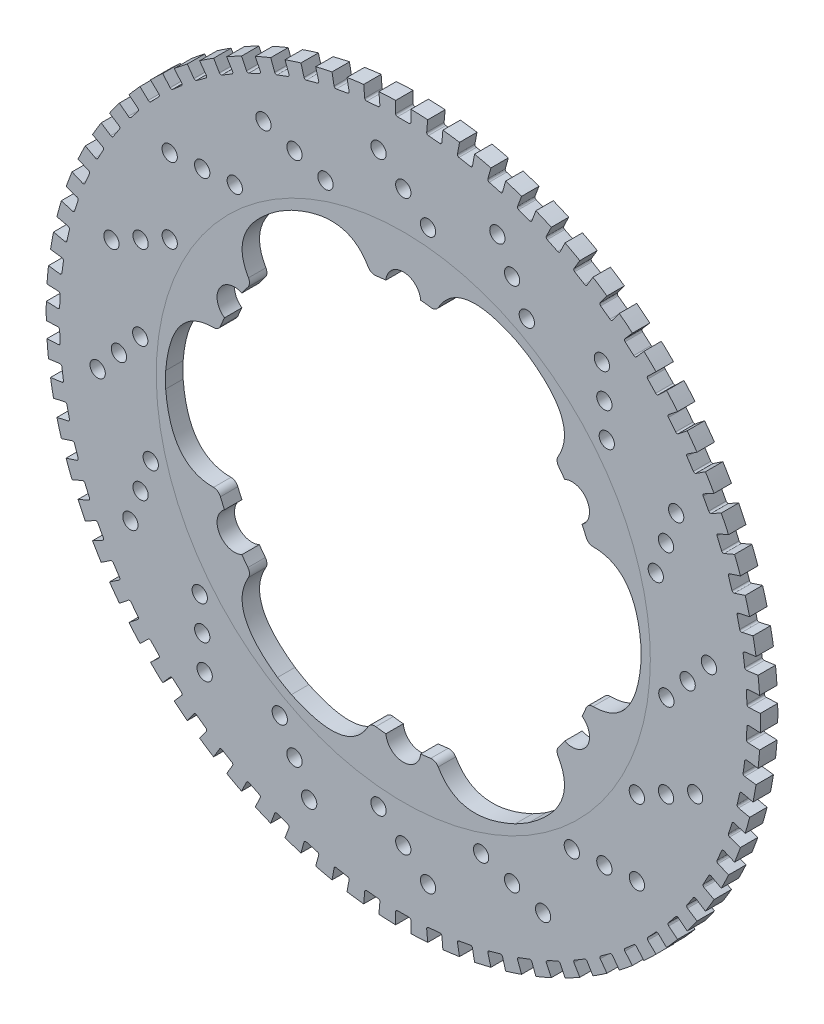
from build123d import *

# Parameters (mm, degrees)
SKETCH2_R                = 95.25
SKETCH2_R_2              = 64.77
ROTORSWEPT_DEPTH         = 4.7498
FLOATPINIF_DEPTH         = 4.7498
FLOATPINPATTERN_COUNT    = 6
SKETCH4_R                = 2.0828
HOLES_DEPTH              = 135.787557434
HOLESPATTERN_COUNT       = 16
FILLET1_R                = 2.032
BOSS_EXTRUDE2_START      = -4.7498
SKETCH8_R                = 97.282
SKETCH8_R_2              = 95.25
BOSS_EXTRUDE2_DEPTH      = 4.7498
SKETCH12_W               = 2.07772
SKETCH12_H               = 4.412748634
CUT_EXTRUDE8_DEPTH       = 4.826
FILLET3_R                = 0.508
CIRPATTERN2_COUNT        = 70
FILLET3_OF_CIRPATTERN2_R = 0.508


with BuildPart() as part:
    # Sketch2 → RotorSwept (new body)
    with BuildSketch(Plane.XY):
        Circle(SKETCH2_R)
        Circle(SKETCH2_R_2, mode=Mode.SUBTRACT)
    extrude(amount=ROTORSWEPT_DEPTH)

    # Sketch3 → FloatPinIF (add, through all)
    with BuildSketch(Plane.XY.offset(4.7498)):
        with BuildLine():
            ThreePointArc((-4.743483699, 53.511168959), (0, 57.8485), (4.743483699, 53.511168959))
            ThreePointArc((4.743483699, 53.511168959), (6.821907433, 53.286090305), (8.89, 52.980314656))
            add(Edge.make_bspline(
                [(8.89, 52.980314656), (14.425343999, 64.673785156), (30.48, 57.15)],
                knots=[0, 0, 0, 1, 1, 1], degree=2))
            ThreePointArc((30.48, 57.15), (0, 64.77), (-30.48, 57.15))
            add(Edge.make_bspline(
                [(-8.89, 52.980314656), (-14.425343999, 64.673785156), (-30.48, 57.15)],
                knots=[0, 0, 0, 1, 1, 1], degree=2))
            ThreePointArc((-8.89, 52.980314656), (-6.821907433, 53.286090305), (-4.743483699, 53.511168959))
        make_face()
    floatpinif = extrude(amount=-FLOATPINIF_DEPTH)

    # FloatPinPattern: FloatPinIF ×6 about axis
    floatpinpattern_axis = Axis((0, 0, 4.7498), (0, 0, -1))
    for i in range(1, FLOATPINPATTERN_COUNT):
        add(floatpinif.rotate(floatpinpattern_axis, i * 360 / FLOATPINPATTERN_COUNT))

    # Sketch4 → Holes (cut, through all)
    with BuildSketch(Plane.XY.offset(4.7498)):
        with Locations((0, 77.47)):
            Circle(SKETCH4_R)
        with Locations((-6.740084385, 83.266840733)):
            Circle(SKETCH4_R)
        with Locations((6.740084385, 71.673159267)):
            Circle(SKETCH4_R)
    holes = extrude(amount=-HOLES_DEPTH, mode=Mode.SUBTRACT)

    # HolesPattern: Holes ×16 about axis
    holespattern_axis = Axis((0, 0, 0), (0, 0, 1))
    for i in range(1, HOLESPATTERN_COUNT):
        add(holes.rotate(holespattern_axis, i * 360 / HOLESPATTERN_COUNT), mode=Mode.SUBTRACT)

    # Fillet1
    fillet1_edges = [part.edges().sort_by_distance(p)[0] for p in [
        (-8.89, -52.980314656, 2.3749),
        (8.89, -52.980314656, 2.3749),
        (41.437298392, -34.189123167, 2.3749),
        (50.327298392, -18.791191488, 2.3749),
        (-50.327298392, -18.791191488, 2.3749),
        (-41.437298392, -34.189123167, 2.3749),
        (-41.437298392, 34.189123167, 2.3749),
        (-50.327298392, 18.791191488, 2.3749),
        (50.327298392, 18.791191488, 2.3749),
        (41.437298392, 34.189123167, 2.3749),
        (8.89, 52.980314656, 2.3749),
        (-8.89, 52.980314656, 2.3749),
    ]]
    fillet(fillet1_edges, radius=FILLET1_R)

    # Sketch8 → Boss-Extrude2 (add)
    with BuildSketch(Plane.XY.offset(4.7498).offset(BOSS_EXTRUDE2_START)):
        Circle(SKETCH8_R)
        Circle(SKETCH8_R_2, mode=Mode.SUBTRACT)
    extrude(amount=BOSS_EXTRUDE2_DEPTH)

    # Sketch12 → Cut-Extrude8 (cut)
    with BuildSketch(Plane.XY.offset(4.7498)):
        with Locations((1.03886, 95.856174317)):
            Rectangle(SKETCH12_W, SKETCH12_H)
        with Locations((-1.03886, 95.856174317)):
            Rectangle(SKETCH12_W, SKETCH12_H)
    cut_extrude8 = extrude(amount=-CUT_EXTRUDE8_DEPTH, mode=Mode.SUBTRACT)

    # Fillet3
    fillet3_edges = [part.edges().sort_by_distance(p)[0] for p in [
        (2.07772, 93.6498, 2.3749),
        (-2.07772, 93.6498, 2.3749),
    ]]
    fillet(fillet3_edges, radius=FILLET3_R)

    # CirPattern2: Cut-Extrude8 ×70 about axis
    cirpattern2_axis = Axis((0, 0, 0), (0, 0, 1))
    for i in range(1, CIRPATTERN2_COUNT):
        add(cut_extrude8.rotate(cirpattern2_axis, i * 360 / CIRPATTERN2_COUNT), mode=Mode.SUBTRACT)

    # Fillet3 of CirPattern2
    fillet3_of_cirpattern2_edges = [part.edges().sort_by_distance(p)[0] for p in [
        (-6.325347641, 93.459038823, 2.3749),
        (-10.464059061, 93.086548053, 2.3749),
        (-14.677487302, 92.515800418, 2.3749),
        (-18.766147671, 91.773817955, 2.3749),
        (-22.911452465, 90.827679186, 2.3749),
        (-26.917142295, 89.722179037, 2.3749),
        (-30.960948085, 88.408266888, 2.3749),
        (-34.851415916, 86.948149889, 2.3749),
        (-38.761164355, 85.277043208, 2.3749),
        (-42.505086428, 83.474065363, 2.3749),
        (-46.249298522, 81.459218918, 2.3749),
        (-49.816530977, 79.327896744, 2.3749),
        (-53.365060531, 76.985532894, 2.3749),
        (-56.72688211, 74.543026545, 2.3749),
        (-60.05115845, 71.892004627, 2.3749),
        (-63.180501743, 69.157979727, 2.3749),
        (-66.253759751, 66.21964421, 2.3749),
        (-69.125429126, 63.216113521, 2.3749),
        (-71.922924736, 60.014122154, 2.3749),
        (-74.513799198, 56.765268338, 2.3749),
        (-77.01300862, 53.325401674, 2.3749),
        (-79.302227973, 49.857382593, 2.3749),
        (-81.483029042, 46.207336415, 2.3749),
        (-83.452161837, 42.548074518, 2.3749),
        (-85.296996025, 38.717236853, 2.3749),
        (-86.930187963, 34.896194366, 2.3749),
        (-88.42420175, 30.915408865, 2.3749),
        (-89.708303329, 26.963350575, 2.3749),
        (-90.839467795, 22.864668183, 2.3749),
        (-91.764140185, 18.813413739, 2.3749),
        (-92.523347859, 14.629834636, 2.3749),
        (-93.081146141, 10.512002358, 2.3749),
        (-93.462284328, 6.277210264, 2.3749),
        (-93.648717438, 2.125954515, 2.3749),
        (-93.648717438, -2.125954515, 2.3749),
        (-93.462284328, -6.277210264, 2.3749),
        (-93.081146141, -10.512002358, 2.3749),
        (-92.523347859, -14.629834636, 2.3749),
        (-91.764140185, -18.813413739, 2.3749),
        (-90.839467795, -22.864668183, 2.3749),
        (-89.708303329, -26.963350575, 2.3749),
        (-88.42420175, -30.915408865, 2.3749),
        (-86.930187963, -34.896194366, 2.3749),
        (-85.296996025, -38.717236853, 2.3749),
        (-83.452161837, -42.548074518, 2.3749),
        (-81.483029042, -46.207336415, 2.3749),
        (-79.302227973, -49.857382593, 2.3749),
        (-77.01300862, -53.325401674, 2.3749),
        (-74.513799198, -56.765268338, 2.3749),
        (-71.922924736, -60.014122154, 2.3749),
        (-69.125429126, -63.216113521, 2.3749),
        (-66.253759751, -66.21964421, 2.3749),
        (-63.180501743, -69.157979727, 2.3749),
        (-60.05115845, -71.892004627, 2.3749),
        (-56.72688211, -74.543026545, 2.3749),
        (-53.365060531, -76.985532894, 2.3749),
        (-49.816530977, -79.327896744, 2.3749),
        (-46.249298522, -81.459218918, 2.3749),
        (-42.505086428, -83.474065363, 2.3749),
        (-38.761164355, -85.277043208, 2.3749),
        (-34.851415916, -86.948149889, 2.3749),
        (-30.960948085, -88.408266888, 2.3749),
        (-26.917142295, -89.722179037, 2.3749),
        (-22.911452465, -90.827679186, 2.3749),
        (-18.766147671, -91.773817955, 2.3749),
        (-14.677487302, -92.515800418, 2.3749),
        (-10.464059061, -93.086548053, 2.3749),
        (-6.325347641, -93.459038823, 2.3749),
        (-2.07772, -93.6498, 2.3749),
        (2.07772, -93.6498, 2.3749),
        (6.325347641, -93.459038823, 2.3749),
        (10.464059061, -93.086548053, 2.3749),
        (14.677487302, -92.515800418, 2.3749),
        (18.766147671, -91.773817955, 2.3749),
        (22.911452465, -90.827679186, 2.3749),
        (26.917142295, -89.722179037, 2.3749),
        (30.960948085, -88.408266888, 2.3749),
        (34.851415916, -86.948149889, 2.3749),
        (38.761164355, -85.277043208, 2.3749),
        (42.505086428, -83.474065363, 2.3749),
        (46.249298522, -81.459218918, 2.3749),
        (49.816530977, -79.327896744, 2.3749),
        (53.365060531, -76.985532894, 2.3749),
        (56.72688211, -74.543026545, 2.3749),
        (60.05115845, -71.892004627, 2.3749),
        (63.180501743, -69.157979727, 2.3749),
        (66.253759751, -66.21964421, 2.3749),
        (69.125429126, -63.216113521, 2.3749),
        (71.922924736, -60.014122154, 2.3749),
        (74.513799198, -56.765268338, 2.3749),
        (77.01300862, -53.325401674, 2.3749),
        (79.302227973, -49.857382593, 2.3749),
        (81.483029042, -46.207336415, 2.3749),
        (83.452161837, -42.548074518, 2.3749),
        (85.296996025, -38.717236853, 2.3749),
        (86.930187963, -34.896194366, 2.3749),
        (88.42420175, -30.915408865, 2.3749),
        (89.708303329, -26.963350575, 2.3749),
        (90.839467795, -22.864668183, 2.3749),
        (91.764140185, -18.813413739, 2.3749),
        (92.523347859, -14.629834636, 2.3749),
        (93.081146141, -10.512002358, 2.3749),
        (93.462284328, -6.277210264, 2.3749),
        (93.648717438, -2.125954515, 2.3749),
        (93.648717438, 2.125954515, 2.3749),
        (93.462284328, 6.277210264, 2.3749),
        (93.081146141, 10.512002358, 2.3749),
        (92.523347859, 14.629834636, 2.3749),
        (91.764140185, 18.813413739, 2.3749),
        (90.839467795, 22.864668183, 2.3749),
        (89.708303329, 26.963350575, 2.3749),
        (88.42420175, 30.915408865, 2.3749),
        (86.930187963, 34.896194366, 2.3749),
        (85.296996025, 38.717236853, 2.3749),
        (83.452161837, 42.548074518, 2.3749),
        (81.483029042, 46.207336415, 2.3749),
        (79.302227973, 49.857382593, 2.3749),
        (77.01300862, 53.325401674, 2.3749),
        (74.513799198, 56.765268338, 2.3749),
        (71.922924736, 60.014122154, 2.3749),
        (69.125429126, 63.216113521, 2.3749),
        (66.253759751, 66.21964421, 2.3749),
        (63.180501743, 69.157979727, 2.3749),
        (60.05115845, 71.892004627, 2.3749),
        (56.72688211, 74.543026545, 2.3749),
        (53.365060531, 76.985532894, 2.3749),
        (49.816530977, 79.327896744, 2.3749),
        (46.249298522, 81.459218918, 2.3749),
        (42.505086428, 83.474065363, 2.3749),
        (38.761164355, 85.277043208, 2.3749),
        (34.851415916, 86.948149889, 2.3749),
        (30.960948085, 88.408266888, 2.3749),
        (26.917142295, 89.722179037, 2.3749),
        (22.911452465, 90.827679186, 2.3749),
        (18.766147671, 91.773817955, 2.3749),
        (14.677487302, 92.515800418, 2.3749),
        (10.464059061, 93.086548053, 2.3749),
        (6.325347641, 93.459038823, 2.3749),
    ]]
    fillet(fillet3_of_cirpattern2_edges, radius=FILLET3_OF_CIRPATTERN2_R)


solid = part.part
